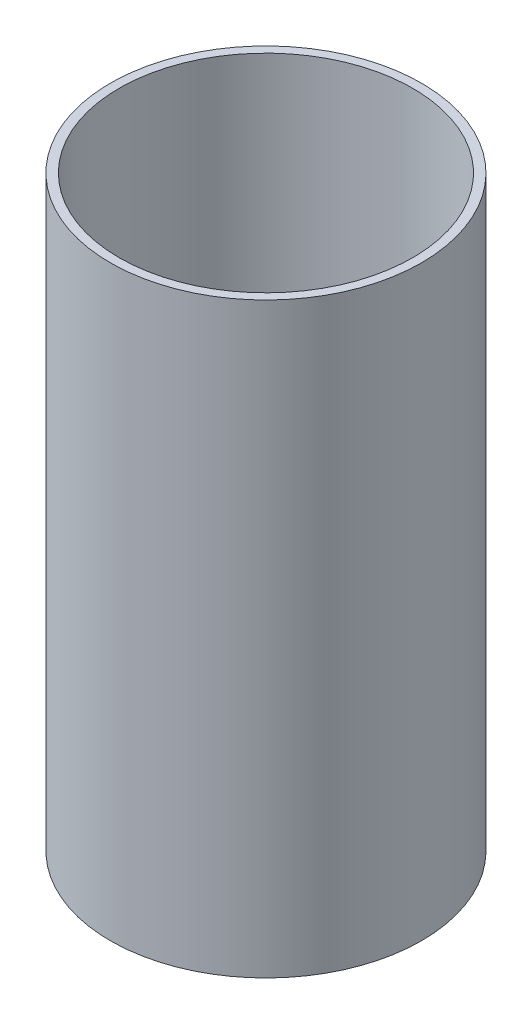
from build123d import *

# Parameters (mm, degrees)
SKETCH1_R           = 26.5
SKETCH1_R_2         = 25
EXTRUDE_THIN1_DEPTH = 100


with BuildPart() as part:
    # Sketch1 → Extrude-Thin1 (new body)
    with BuildSketch(Plane(origin=(0, 0, 0), x_dir=(1, 0, 0), z_dir=(0, 1, 0))):
        Circle(SKETCH1_R)
        Circle(SKETCH1_R_2, mode=Mode.SUBTRACT)
    extrude(amount=EXTRUDE_THIN1_DEPTH)


solid = part.part
